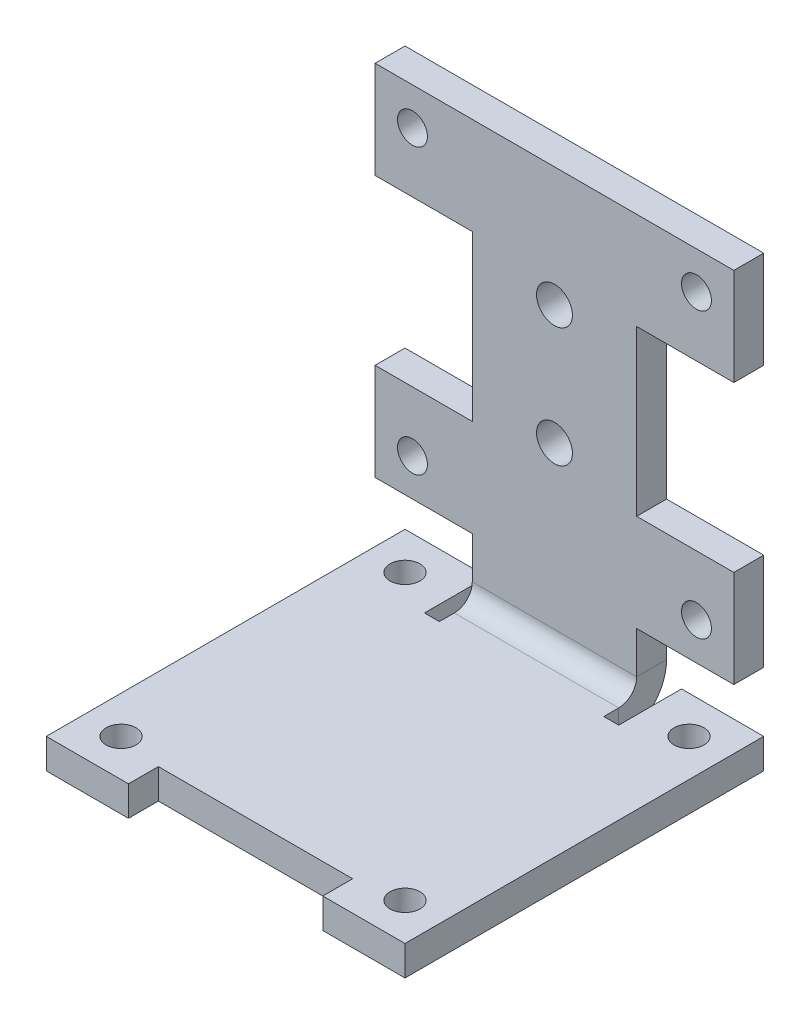
from build123d import *

# Parameters (mm, degrees)
SKETCH_1_R                        = 2.5
SM_BASE_FLANGE_1_DEPTH            = 5
SM_EDGE_FLANGE_1_STRIP_W          = 26
SM_EDGE_FLANGE_1_STRIP_H          = 5
SM_EDGE_FLANGE_1_STRIP_CUT_DEPTH  = 27.5
SM_EDGE_FLANGE_1_RELIEF_W         = 28.5
SM_EDGE_FLANGE_1_RELIEF_H         = 2.5
SM_EDGE_FLANGE_1_RELIEF_CUT_DEPTH = 5
SM_EDGE_FLANGE_1_DEPTH            = 27.5
EXTRUDE_START                     = -30
SKETCH_9_W                        = 16.25
SKETCH_9_H                        = 16.25
EXTRUDE_1_DEPTH                   = 5
CUT_EXTRUDE_START                 = -30
SKETCH_10_R                       = 3
CUT_EXTRUDE_1_DEPTH               = 5
SKETCH_11_R                       = 2.5
CUT_EXTRUDE_2_DEPTH               = 5


# Sheet-metal steps are written as plain solids
with BuildPart() as part:
    # Sketch 1 → 基体-法兰1 (new body)
    with BuildSketch(Plane(origin=(0, 0, 0), x_dir=(1, 0, 0), z_dir=(0, 1, 0))):
        Polygon((-16.25, 25), (-16.25, 30), (-30, 30), (-30, -30), (-16.25, -30), (-16.25, -25), (16.25, -25), (16.25, -30), (30, -30), (30, 30), (16.25, 30), (16.25, 25), align=None)
        with Locations(Location((-23.75, 23.75, 0), (0, 0, 270))):
            Circle(SKETCH_1_R, mode=Mode.SUBTRACT)
        with Locations(Location((23.75, 23.75, 0), (0, 0, 270))):
            Circle(SKETCH_1_R, mode=Mode.SUBTRACT)
        with Locations(Location((-23.75, -23.75, 0), (0, 0, 270))):
            Circle(SKETCH_1_R, mode=Mode.SUBTRACT)
        with Locations(Location((23.75, -23.75, 0), (0, 0, 270))):
            Circle(SKETCH_1_R, mode=Mode.SUBTRACT)
    extrude(amount=-SM_BASE_FLANGE_1_DEPTH)

    # 边线-法兰1 strip (across the edge) → 边线-法兰1 strip cut (cut)
    with BuildSketch(Plane(origin=(13.75, 0, -25), x_dir=(0, 0, 1), z_dir=(-1, 0, 0))):
        with Locations((-10, -2.5)):
            Rectangle(SM_EDGE_FLANGE_1_STRIP_W, SM_EDGE_FLANGE_1_STRIP_H)
    extrude(amount=SM_EDGE_FLANGE_1_STRIP_CUT_DEPTH, mode=Mode.SUBTRACT)

    # 边线-法兰1 relief (on the sheet) → 边线-法兰1 relief cut (cut)
    with BuildSketch(Plane(origin=(13.75, 0, -22), x_dir=(0, 0, 1), z_dir=(0, 1, 0))):
        with Locations((-11.75, 1.25)):
            Rectangle(SM_EDGE_FLANGE_1_RELIEF_W, SM_EDGE_FLANGE_1_RELIEF_H)
        with Locations((-11.75, -28.75)):
            Rectangle(SM_EDGE_FLANGE_1_RELIEF_W, SM_EDGE_FLANGE_1_RELIEF_H)
    extrude(amount=-SM_EDGE_FLANGE_1_RELIEF_CUT_DEPTH, mode=Mode.SUBTRACT)

    # 边线-法兰1 section (across the edge) → 边线-法兰1 (add)
    with BuildSketch(Plane(origin=(13.75, 0, -25), x_dir=(0, 0, 1), z_dir=(-1, 0, 0))):
        with BuildLine():
            Line((-5, 3), (-5, 70))
            Line((-5, 70), (0, 70))
            Line((0, 70), (0, 3))
            ThreePointArc((0, 3), (0.878679656, 0.878679656), (3, 0))
            Line((3, 0), (3, -5))
            ThreePointArc((3, -5), (-2.656854249, -2.656854249), (-5, 3))
        make_face()
    extrude(amount=SM_EDGE_FLANGE_1_DEPTH)

    # 草图9 → 凸台-拉伸1 (add)
    with BuildSketch(Plane.XY.offset(EXTRUDE_START)):
        with Locations((-21.875, 61.875)):
            Rectangle(SKETCH_9_W, SKETCH_9_H)
        with Locations((21.875, 61.875)):
            Rectangle(SKETCH_9_W, SKETCH_9_H)
        with Locations((-21.875, 18.125)):
            Rectangle(SKETCH_9_W, SKETCH_9_H)
        with Locations((21.875, 18.125)):
            Rectangle(SKETCH_9_W, SKETCH_9_H)
    extrude(amount=EXTRUDE_1_DEPTH)

    # 草图10 → 切除-拉伸1 (cut)
    with BuildSketch(Plane.XY.offset(CUT_EXTRUDE_START)):
        with Locations(Location((0, 50, 0), (0, 0, 90))):
            Circle(SKETCH_10_R)
        with Locations(Location((0, 30, 0), (0, 0, 90))):
            Circle(SKETCH_10_R)
    extrude(amount=CUT_EXTRUDE_1_DEPTH, mode=Mode.SUBTRACT)

    # 草图11 → 切除-拉伸2 (cut)
    with BuildSketch(Plane.XY.offset(CUT_EXTRUDE_START)):
        with Locations(Location((-23.75, 16.25, 0), (0, 0, 90))):
            Circle(SKETCH_11_R)
        with Locations(Location((-23.75, 63.75, 0), (0, 0, 90))):
            Circle(SKETCH_11_R)
        with Locations(Location((23.75, 63.75, 0), (0, 0, 90))):
            Circle(SKETCH_11_R)
        with Locations(Location((23.75, 16.25, 0), (0, 0, 90))):
            Circle(SKETCH_11_R)
    extrude(amount=CUT_EXTRUDE_2_DEPTH, mode=Mode.SUBTRACT)


solid = part.part
